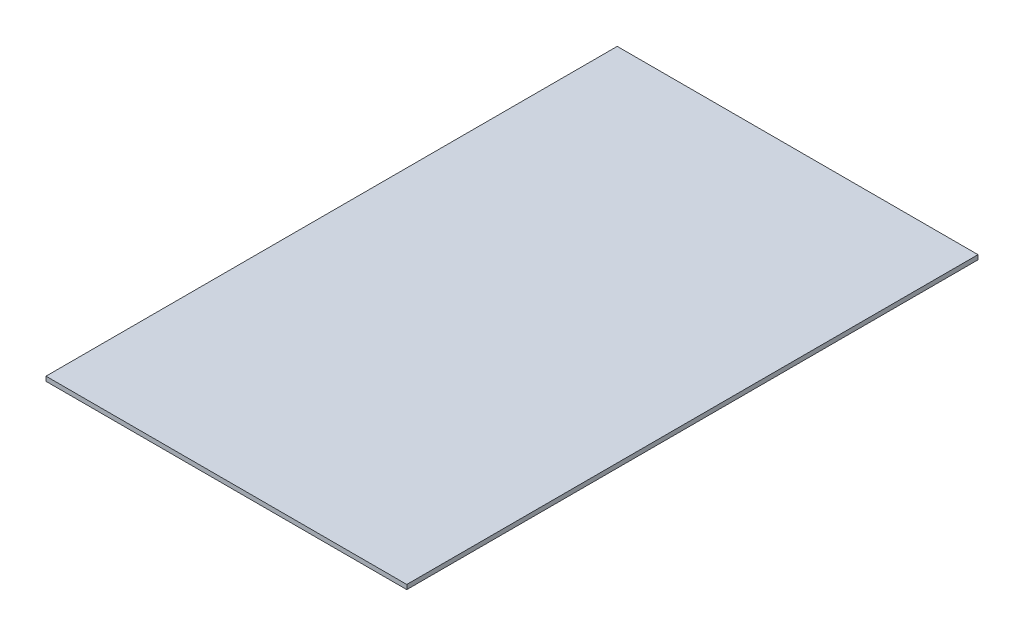
from build123d import *

# Parameters (mm, degrees)
SKETCH3_W           = 152.4
SKETCH3_H           = 241.3
BOSS_EXTRUDE2_DEPTH = 1.905


with BuildPart() as part:
    # Sketch3 → Boss-Extrude2 (new body)
    with BuildSketch(Plane(origin=(0, 0, 0), x_dir=(1, 0, 0), z_dir=(0, 1, 0))):
        with Locations((76.2, 120.65)):
            Rectangle(SKETCH3_W, SKETCH3_H)
    extrude(amount=BOSS_EXTRUDE2_DEPTH)


solid = part.part
